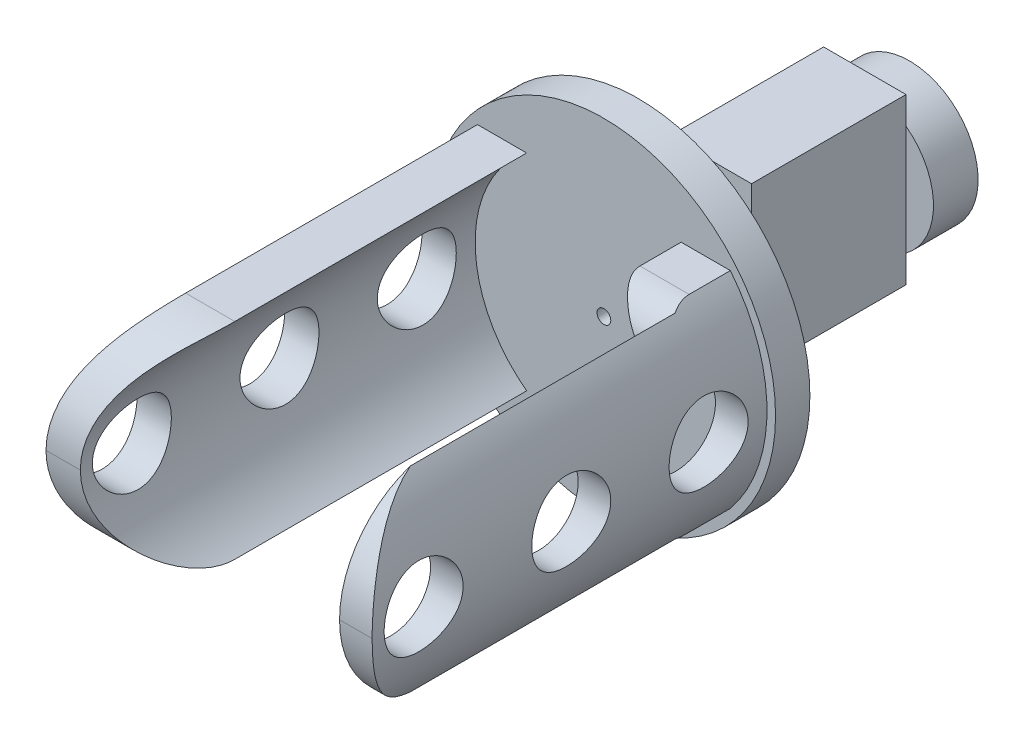
from build123d import *

# Parameters (mm, degrees)
ESQUISSE1_R                  = 50
BOSS_EXTRU_1_DEPTH           = 10
ESQUISSE2_R                  = 47.5
ENL_V_MAT_EXTRU_1_DEPTH      = 5
BOSS_EXTRU_4_DEPTH           = 115
ESQUISSE7_R                  = 2
ENL_V_MAT_EXTRU_2_DEPTH      = 100
ESQUISSE12_W                 = 3.643670962
ESQUISSE12_H                 = 10.037282272
BOSS_EXTRU_7_DEPTH           = 116
ENL_V_MAT_EXTRU_3_DEPTH      = 145.485293369
ENL_V_MAT_EXTRU_3_DEPTH_BACK = 145.485293369
ESQUISSE14_R                 = 11.5
ESQUISSE15_W                 = 3.643670962
ESQUISSE15_H                 = 10.037282272
ENL_V_MAT_EXTRU_4_DEPTH      = 116
BOSS_EXTRU_8_START           = 16
ESQUISSE16_R                 = 20
ESQUISSE16_R_2               = 2
BOSS_EXTRU_8_DEPTH           = 16
ENL_V_MAT_EXTRU_7_DEPTH      = 16
CONG_3_START                 = -49
CONG_3_DEPTH                 = 97
ESQUISSE18_W                 = 2
ESQUISSE18_H                 = 2
ENL_V_MAT_EXTRU_8_DEPTH      = 150
ENL_V_START                  = 20
ESQUISSE21_W                 = 63
ESQUISSE21_H                 = 13
ENL_V_MAT_EXTRU_9_DEPTH      = 20
CONG_4_R                     = 10
ESQUISSE22_R                 = 15
BOSS_EXTRU_9_DEPTH           = 10
ESQUISSE23_W                 = 24
ESQUISSE23_H                 = 48
BOSS_EXTRU_10_DEPTH          = 45
ESQUISSE24_R                 = 20
BOSS_EXTRU_11_DEPTH          = 5
ESQUISSE25_R                 = 20
ESQUISSE25_R_2               = 11.5
BOSS_EXTRU_12_DEPTH          = 8


with BuildPart() as part:
    # Esquisse1 → Boss.-Extru.1 (new body)
    with BuildSketch(Plane.XY):
        Circle(ESQUISSE1_R)
    extrude(amount=BOSS_EXTRU_1_DEPTH)

    # Esquisse2 → Enlèv. mat.-Extru.1 (cut)
    with BuildSketch(Plane(origin=(0, 0, 0), x_dir=(-1, 0, 0), z_dir=(0, 0, -1))):
        Circle(ESQUISSE2_R)
    extrude(amount=-ENL_V_MAT_EXTRU_1_DEPTH, mode=Mode.SUBTRACT)

    # Esquisse6 → Boss.-Extru.4 (add)
    with BuildSketch(Plane.XY.offset(10)):
        with BuildLine():
            ThreePointArc((-22.5, -30), (-37.5, 0), (-22.5, 30))
            Line((-22.5, 30), (-36.827299657, 30))
            ThreePointArc((-36.827299657, 30), (-47.5, 0), (-36.827299657, -30))
            Line((-36.827299657, -30), (-22.5, -30))
        make_face()
        with BuildLine():
            Line((36.827299657, 30), (22.5, 30))
            ThreePointArc((22.5, 30), (33.541019662, 16.770509831), (37.5, 0))
            ThreePointArc((37.5, 0), (33.541019662, -16.770509831), (22.5, -30))
            Line((22.5, -30), (36.827299657, -30))
            ThreePointArc((36.827299657, -30), (44.752355992, -15.920949505), (47.5, 0))
            ThreePointArc((47.5, 0), (44.752355992, 15.920949505), (36.827299657, 30))
        make_face()
    extrude(amount=BOSS_EXTRU_4_DEPTH)

    # Esquisse7 → Enlèv. mat.-Extru.2 (cut)
    with BuildSketch(Plane(origin=(0, 0, 5), x_dir=(-1, 0, 0), z_dir=(0, 0, -1))):
        Circle(ESQUISSE7_R)
    extrude(amount=-ENL_V_MAT_EXTRU_2_DEPTH, mode=Mode.SUBTRACT)

    # Esquisse12 → Boss.-Extru.7 (add)
    with BuildSketch(Plane.XY.offset(10)):
        with Locations((-1.821835481, 20.143313052)):
            Rectangle(ESQUISSE12_W, ESQUISSE12_H)
    extrude(amount=BOSS_EXTRU_7_DEPTH)

    # Esquisse14 → Enlèv. mat.-Extru.3 (cut, two sides: drawn at the far end of the back side and taken through both)
    with BuildSketch(Plane(origin=(0, 0, 0), x_dir=(0, 0, -1), z_dir=(1, 0, 0)).offset(-ENL_V_MAT_EXTRU_3_DEPTH_BACK)):
        with Locations((-110, 0)):
            Circle(ESQUISSE14_R)
        with Locations((-67, 0)):
            Circle(ESQUISSE14_R)
        with Locations((-27, 0)):
            Circle(ESQUISSE14_R)
    extrude(amount=ENL_V_MAT_EXTRU_3_DEPTH + ENL_V_MAT_EXTRU_3_DEPTH_BACK, mode=Mode.SUBTRACT)

    # Esquisse15 → Enlèv. mat.-Extru.4 (cut)
    with BuildSketch(Plane.XY.offset(126)):
        with Locations((-1.821835481, 20.143313052)):
            Rectangle(ESQUISSE15_W, ESQUISSE15_H)
    extrude(amount=-ENL_V_MAT_EXTRU_4_DEPTH, mode=Mode.SUBTRACT)

    # Esquisse16 → Boss.-Extru.8 (add)
    with BuildSketch(Plane(origin=(0, 0, 5), x_dir=(-1, 0, 0), z_dir=(0, 0, -1)).offset(BOSS_EXTRU_8_START)):
        Circle(ESQUISSE16_R)
        Circle(ESQUISSE16_R_2, mode=Mode.SUBTRACT)
    extrude(amount=-BOSS_EXTRU_8_DEPTH)

    # Esquisse17 → Enlèv. mat.-Extru.7 (cut)
    with BuildSketch(Plane(origin=(0, 0, -11), x_dir=(-1, 0, 0), z_dir=(0, 0, -1))):
        with BuildLine():
            Line((-15.930439153, -1.577135301), (-20, 0))
            ThreePointArc((-20, 0), (-19.903458044, -1.962742436), (-19.614764213, -3.906536174))
            Line((-19.614764213, -3.906536174), (-15.930439153, -1.577135301))
        make_face()
        with BuildLine():
            Line((-15.324501649, -4.655091779), (-19.614764213, -3.906536174))
            ThreePointArc((-19.614764213, -3.906536174), (-19.137506327, -5.809978621), (-18.476008403, -7.657487414))
            Line((-18.476008403, -7.657487414), (-15.324501649, -4.655091779))
        make_face()
        with BuildLine():
            Line((-14.124586248, -7.550251226), (-18.476008403, -7.657487414))
            ThreePointArc((-18.476008403, -7.657487414), (-17.636638794, -9.431276268), (-16.627478254, -11.114268617))
            Line((-16.627478254, -11.114268617), (-14.124586248, -7.550251226))
        make_face()
        with BuildLine():
            Line((-12.372592986, -10.15377227), (-16.627478254, -11.114268617))
            ThreePointArc((-16.627478254, -11.114268617), (-15.458242145, -12.690262006), (-14.140186901, -14.144084078))
            Line((-14.140186901, -14.144084078), (-12.372592986, -10.15377227))
        make_face()
        with BuildLine():
            Line((-10.150362344, -12.375390612), (-14.140186901, -14.144084078))
            ThreePointArc((-14.140186901, -14.144084078), (-12.686001666, -15.461738639), (-11.109686128, -16.630540404))
            Line((-11.109686128, -16.630540404), (-10.150362344, -12.375390612))
        make_face()
        with BuildLine():
            Line((-7.546358599, -14.12666635), (-11.109686128, -16.630540404))
            ThreePointArc((-11.109686128, -16.630540404), (-9.426415747, -17.63923712), (-7.652395653, -18.478117891))
            Line((-7.652395653, -18.478117891), (-7.546358599, -14.12666635))
        make_face()
        with BuildLine():
            Line((-4.650868598, -15.32578388), (-7.652395653, -18.478117891))
            ThreePointArc((-7.652395653, -18.478117891), (-5.80470464, -19.139106668), (-3.901130746, -19.61584))
            Line((-3.901130746, -19.61584), (-4.650868598, -15.32578388))
        make_face()
        with BuildLine():
            Line((-1.571137891, -15.928329298), (-3.901130746, -19.61584))
            ThreePointArc((-3.901130746, -19.61584), (-1.96, -19.903728294), (0, -20))
            Line((0, -20), (-1.571137891, -15.928329298))
        make_face()
        with BuildLine():
            ThreePointArc((0, -20), (1.96, -19.903728294), (3.901130746, -19.61584))
            Line((3.901130746, -19.61584), (1.571137891, -15.928329298))
            Line((1.571137891, -15.928329298), (0, -20))
        make_face()
        with BuildLine():
            ThreePointArc((3.901130746, -19.61584), (5.80470464, -19.139106668), (7.652395653, -18.478117891))
            Line((7.652395653, -18.478117891), (4.650868598, -15.32578388))
            Line((4.650868598, -15.32578388), (3.901130746, -19.61584))
        make_face()
        with BuildLine():
            ThreePointArc((7.652395653, -18.478117891), (9.426415747, -17.63923712), (11.109686128, -16.630540404))
            Line((11.109686128, -16.630540404), (7.546358599, -14.12666635))
            Line((7.546358599, -14.12666635), (7.652395653, -18.478117891))
        make_face()
        with BuildLine():
            ThreePointArc((11.109686128, -16.630540404), (12.686001666, -15.461738639), (14.140186901, -14.144084078))
            Line((14.140186901, -14.144084078), (10.150362344, -12.375390612))
            Line((10.150362344, -12.375390612), (11.109686128, -16.630540404))
        make_face()
        with BuildLine():
            ThreePointArc((14.140186901, -14.144084078), (15.458242145, -12.690262006), (16.627478254, -11.114268617))
            Line((16.627478254, -11.114268617), (12.372592986, -10.15377227))
            Line((12.372592986, -10.15377227), (14.140186901, -14.144084078))
        make_face()
        with BuildLine():
            ThreePointArc((16.627478254, -11.114268617), (17.636638794, -9.431276268), (18.476008403, -7.657487414))
            Line((18.476008403, -7.657487414), (14.124586248, -7.550251226))
            Line((14.124586248, -7.550251226), (16.627478254, -11.114268617))
        make_face()
        with BuildLine():
            ThreePointArc((18.476008403, -7.657487414), (19.137506327, -5.809978621), (19.614764213, -3.906536174))
            Line((19.614764213, -3.906536174), (15.324501649, -4.655091779))
            Line((15.324501649, -4.655091779), (18.476008403, -7.657487414))
        make_face()
        with BuildLine():
            ThreePointArc((19.614764213, -3.906536174), (19.903458044, -1.962742436), (20, 0))
            Line((20, 0), (15.930439153, -1.577135301))
            Line((15.930439153, -1.577135301), (19.614764213, -3.906536174))
        make_face()
        with BuildLine():
            ThreePointArc((20, 0), (19.903458044, 1.962742436), (19.614764213, 3.906536174))
            Line((19.614764213, 3.906536174), (15.930439153, 1.577135301))
            Line((15.930439153, 1.577135301), (20, 0))
        make_face()
        with BuildLine():
            ThreePointArc((19.614764213, 3.906536174), (19.137506327, 5.809978621), (18.476008403, 7.657487414))
            Line((18.476008403, 7.657487414), (15.324501649, 4.655091779))
            Line((15.324501649, 4.655091779), (19.614764213, 3.906536174))
        make_face()
        with BuildLine():
            ThreePointArc((18.476008403, 7.657487414), (17.636638794, 9.431276268), (16.627478254, 11.114268617))
            Line((16.627478254, 11.114268617), (14.124586248, 7.550251226))
            Line((14.124586248, 7.550251226), (18.476008403, 7.657487414))
        make_face()
        with BuildLine():
            ThreePointArc((16.627478254, 11.114268617), (15.458242145, 12.690262006), (14.140186901, 14.144084078))
            Line((14.140186901, 14.144084078), (12.372592986, 10.15377227))
            Line((12.372592986, 10.15377227), (16.627478254, 11.114268617))
        make_face()
        with BuildLine():
            ThreePointArc((14.140186901, 14.144084078), (12.686001666, 15.461738639), (11.109686128, 16.630540404))
            Line((11.109686128, 16.630540404), (10.150362344, 12.375390612))
            Line((10.150362344, 12.375390612), (14.140186901, 14.144084078))
        make_face()
        with BuildLine():
            ThreePointArc((11.109686128, 16.630540404), (9.426415747, 17.63923712), (7.652395653, 18.478117891))
            Line((7.652395653, 18.478117891), (7.546358599, 14.12666635))
            Line((7.546358599, 14.12666635), (11.109686128, 16.630540404))
        make_face()
        with BuildLine():
            ThreePointArc((7.652395653, 18.478117891), (5.80470464, 19.139106668), (3.901130746, 19.61584))
            Line((3.901130746, 19.61584), (4.650868598, 15.32578388))
            Line((4.650868598, 15.32578388), (7.652395653, 18.478117891))
        make_face()
        with BuildLine():
            ThreePointArc((3.901130746, 19.61584), (1.96, 19.903728294), (0, 20))
            Line((0, 20), (1.571137891, 15.928329298))
            Line((1.571137891, 15.928329298), (3.901130746, 19.61584))
        make_face()
        with BuildLine():
            Line((-1.571137891, 15.928329298), (0, 20))
            ThreePointArc((0, 20), (-1.96, 19.903728294), (-3.901130746, 19.61584))
            Line((-3.901130746, 19.61584), (-1.571137891, 15.928329298))
        make_face()
        with BuildLine():
            Line((-4.650868598, 15.32578388), (-3.901130746, 19.61584))
            ThreePointArc((-3.901130746, 19.61584), (-5.80470464, 19.139106668), (-7.652395653, 18.478117891))
            Line((-7.652395653, 18.478117891), (-4.650868598, 15.32578388))
        make_face()
        with BuildLine():
            Line((-7.546358599, 14.12666635), (-7.652395653, 18.478117891))
            ThreePointArc((-7.652395653, 18.478117891), (-9.426415747, 17.63923712), (-11.109686128, 16.630540404))
            Line((-11.109686128, 16.630540404), (-7.546358599, 14.12666635))
        make_face()
        with BuildLine():
            Line((-10.150362344, 12.375390612), (-11.109686128, 16.630540404))
            ThreePointArc((-11.109686128, 16.630540404), (-12.686001666, 15.461738639), (-14.140186901, 14.144084078))
            Line((-14.140186901, 14.144084078), (-10.150362344, 12.375390612))
        make_face()
        with BuildLine():
            Line((-12.372592986, 10.15377227), (-14.140186901, 14.144084078))
            ThreePointArc((-14.140186901, 14.144084078), (-15.458242145, 12.690262006), (-16.627478254, 11.114268617))
            Line((-16.627478254, 11.114268617), (-12.372592986, 10.15377227))
        make_face()
        with BuildLine():
            Line((-14.124586248, 7.550251226), (-16.627478254, 11.114268617))
            ThreePointArc((-16.627478254, 11.114268617), (-17.636638794, 9.431276268), (-18.476008403, 7.657487414))
            Line((-18.476008403, 7.657487414), (-14.124586248, 7.550251226))
        make_face()
        with BuildLine():
            Line((-15.324501649, 4.655091779), (-18.476008403, 7.657487414))
            ThreePointArc((-18.476008403, 7.657487414), (-19.137506327, 5.809978621), (-19.614764213, 3.906536174))
            Line((-19.614764213, 3.906536174), (-15.324501649, 4.655091779))
        make_face()
        with BuildLine():
            Line((-15.930439153, 1.577135301), (-19.614764213, 3.906536174))
            ThreePointArc((-19.614764213, 3.906536174), (-19.903458044, 1.962742436), (-20, 0))
            Line((-20, 0), (-15.930439153, 1.577135301))
        make_face()
    extrude(amount=-ENL_V_MAT_EXTRU_7_DEPTH, mode=Mode.SUBTRACT)

    # Congé3: read off the stored shape, not the designer's step
    # Congé3 outline → Congé3 (cut)
    with BuildSketch(Plane.YZ.offset(CONG_3_START)):
        with BuildLine():
            ThreePointArc((-30, 95), (-21.213203436, 116.213203436), (0, 125))
            Line((0, 125), (-30, 125))
            Line((-30, 125), (-30, 95))
        make_face()
        with BuildLine():
            ThreePointArc((0, 125), (21.213203436, 116.213203436), (30, 95))
            Line((30, 95), (30, 125))
            Line((30, 125), (0, 125))
        make_face()
    extrude(amount=CONG_3_DEPTH, mode=Mode.SUBTRACT)

    # Esquisse18 → Enlèv. mat.-Extru.8 (cut)
    with BuildSketch(Plane.XY.offset(10)):
        with BuildLine():
            Line((37, 15), (37, 6.103277808))
            ThreePointArc((37, 6.103277808), (37.5, 0), (37, -6.103277808))
            Line((37, -6.103277808), (37, -15))
            Line((37, -15), (37, -17))
            Line((37, -17), (38, -17))
            Line((38, -17), (38, 17))
            Line((38, 17), (37, 17))
            Line((37, 17), (37, 15))
        make_face()
        with BuildLine():
            Line((35, 13.462912018), (35, 0))
            Line((35, 0), (37, 0))
            Line((37, 0), (37, 6.103277808))
            ThreePointArc((37, 6.103277808), (36.187581488, 9.834070677), (35, 13.462912018))
        make_face()
        with BuildLine():
            Line((35, 15), (35, 13.462912018))
            ThreePointArc((35, 13.462912018), (36.187581488, 9.834070677), (37, 6.103277808))
            Line((37, 6.103277808), (37, 15))
            Line((37, 15), (35, 15))
        make_face()
        with Locations((36, 16)):
            Rectangle(ESQUISSE18_W, ESQUISSE18_H)
        with BuildLine():
            Line((37, 0), (35, 0))
            Line((35, 0), (35, -13.462912018))
            ThreePointArc((35, -13.462912018), (36.187581488, -9.834070677), (37, -6.103277808))
            Line((37, -6.103277808), (37, 0))
        make_face()
        with BuildLine():
            ThreePointArc((37, -6.103277808), (36.187581488, -9.834070677), (35, -13.462912018))
            Line((35, -13.462912018), (35, -15))
            Line((35, -15), (37, -15))
            Line((37, -15), (37, -6.103277808))
        make_face()
        with Locations((36, -16)):
            Rectangle(ESQUISSE18_W, ESQUISSE18_H)
        with BuildLine():
            ThreePointArc((33.425289827, 17), (34.258324825, 15.251792688), (35, 13.462912018))
            Line((35, 13.462912018), (35, 15))
            Line((35, 15), (35, 17))
            Line((35, 17), (33.425289827, 17))
        make_face()
        with BuildLine():
            Line((35, -15), (35, -13.462912018))
            ThreePointArc((35, -13.462912018), (34.258324825, -15.251792688), (33.425289827, -17))
            Line((33.425289827, -17), (35, -17))
            Line((35, -17), (35, -15))
        make_face()
    extrude(amount=ENL_V_MAT_EXTRU_8_DEPTH, mode=Mode.SUBTRACT)

    # Esquisse21 → Enlèv. mat.-Extru.9 (cut)
    with BuildSketch(Plane.ZY.offset(-38).offset(ENL_V_START)):
        with BuildLine():
            Line((125, 30), (32, 30))
            Line((32, 30), (32, 17))
            Line((32, 17), (119.718414189, 17))
            ThreePointArc((119.718414189, 17), (123.649192185, 8.900774526), (125, 0))
            Line((125, 0), (125, 30))
        make_face()
        with BuildLine():
            Line((119.718414189, 17), (32, 17))
            Line((32, 17), (32, 10.356157589))
            ThreePointArc((32, 10.356157589), (36.740379869, 6.11350963), (38.5, 0))
            Line((38.5, 0), (55.5, 0))
            ThreePointArc((55.5, 0), (67, 11.5), (78.5, 0))
            Line((78.5, 0), (95, 0))
            Line((95, 0), (98.5, 0))
            ThreePointArc((98.5, 0), (110, 11.5), (121.5, 0))
            Line((121.5, 0), (125, 0))
            ThreePointArc((125, 0), (123.649192185, 8.900774526), (119.718414189, 17))
        make_face()
        with BuildLine():
            Line((55.5, 0), (38.5, 0))
            ThreePointArc((38.5, 0), (36.740379869, -6.11350963), (32, -10.356157589))
            Line((32, -10.356157589), (32, -17))
            Line((32, -17), (95, -17))
            Line((95, -17), (95, 0))
            Line((95, 0), (78.5, 0))
            ThreePointArc((78.5, 0), (67, -11.5), (55.5, 0))
        make_face()
        with BuildLine():
            ThreePointArc((119.718414189, -17), (123.649192185, -8.900774526), (125, 0))
            Line((125, 0), (121.5, 0))
            ThreePointArc((121.5, 0), (110, -11.5), (98.5, 0))
            Line((98.5, 0), (95, 0))
            Line((95, 0), (95, -17))
            Line((95, -17), (119.718414189, -17))
        make_face()
        with Locations((63.5, -23.5)):
            Rectangle(ESQUISSE21_W, ESQUISSE21_H)
        with BuildLine():
            Line((125, -30), (125, 0))
            ThreePointArc((125, 0), (123.649192185, -8.900774526), (119.718414189, -17))
            Line((119.718414189, -17), (95, -17))
            Line((95, -17), (95, -30))
            Line((95, -30), (125, -30))
        make_face()
    extrude(amount=-ENL_V_MAT_EXTRU_9_DEPTH, mode=Mode.SUBTRACT)

    # Congé4
    # the kernel refuses this fillet: 10 mm, written as the material it takes off along each edge
    with BuildSketch(Plane(origin=(-2.5, -30, 32), x_dir=(0, 1, 0), z_dir=(1, 0, 0))) as cong_4_piece_1_section:
        with BuildLine():
            CenterArc((CONG_4_R, -CONG_4_R), CONG_4_R, 90, 90)
            Line((0, -CONG_4_R), (0, 0))
            Line((0, 0), (CONG_4_R, 0))
        make_face()
    cong_4_piece_1 = extrude(amount=64.327299657, mode=Mode.PRIVATE)
    cong_4_piece_1 = split(cong_4_piece_1, bisect_by=Plane(origin=(38, -30, 32), z_dir=(-1, 0, 0)), keep=Keep.TOP, mode=Mode.PRIVATE)
    add(cong_4_piece_1, mode=Mode.SUBTRACT)
    with BuildSketch(Plane(origin=(-2.5, 30, 32), x_dir=(0, -1, 0), z_dir=(1, 0, 0))) as cong_4_piece_2_section:
        with BuildLine():
            CenterArc((CONG_4_R, CONG_4_R), CONG_4_R, 180, 90)
            Line((0, CONG_4_R), (0, 0))
            Line((0, 0), (CONG_4_R, 0))
        make_face()
    cong_4_piece_2 = extrude(amount=64.327299657, mode=Mode.PRIVATE)
    cong_4_piece_2 = split(cong_4_piece_2, bisect_by=Plane(origin=(38, 30, 32), z_dir=(-1, 0, 0)), keep=Keep.TOP, mode=Mode.PRIVATE)
    add(cong_4_piece_2, mode=Mode.SUBTRACT)

    # Esquisse22 → Boss.-Extru.9 (add)
    with BuildSketch(Plane(origin=(0, 0, -11), x_dir=(-1, 0, 0), z_dir=(0, 0, -1))):
        Circle(ESQUISSE22_R)
    extrude(amount=BOSS_EXTRU_9_DEPTH)

    # Esquisse23 → Boss.-Extru.10 (add)
    with BuildSketch(Plane(origin=(0, 0, -21), x_dir=(-1, 0, 0), z_dir=(0, 0, -1))):
        Rectangle(ESQUISSE23_W, ESQUISSE23_H)
    extrude(amount=BOSS_EXTRU_10_DEPTH)

    # Esquisse24 → Boss.-Extru.11 (add)
    with BuildSketch(Plane(origin=(0, 0, -66), x_dir=(-1, 0, 0), z_dir=(0, 0, -1))):
        with Locations(Location((0, 0, 0), (0, 0, 126.869897646))):
            Circle(ESQUISSE24_R)
    extrude(amount=BOSS_EXTRU_11_DEPTH)

    # Esquisse25 → Boss.-Extru.12 (add)
    with BuildSketch(Plane(origin=(0, 0, -71), x_dir=(-1, 0, 0), z_dir=(0, 0, -1))):
        with Locations(Location((0, 0, 0), (0, 0, 126.869897646))):
            Circle(ESQUISSE25_R)
        Circle(ESQUISSE25_R_2, mode=Mode.SUBTRACT)
    extrude(amount=BOSS_EXTRU_12_DEPTH)


solid = part.part
